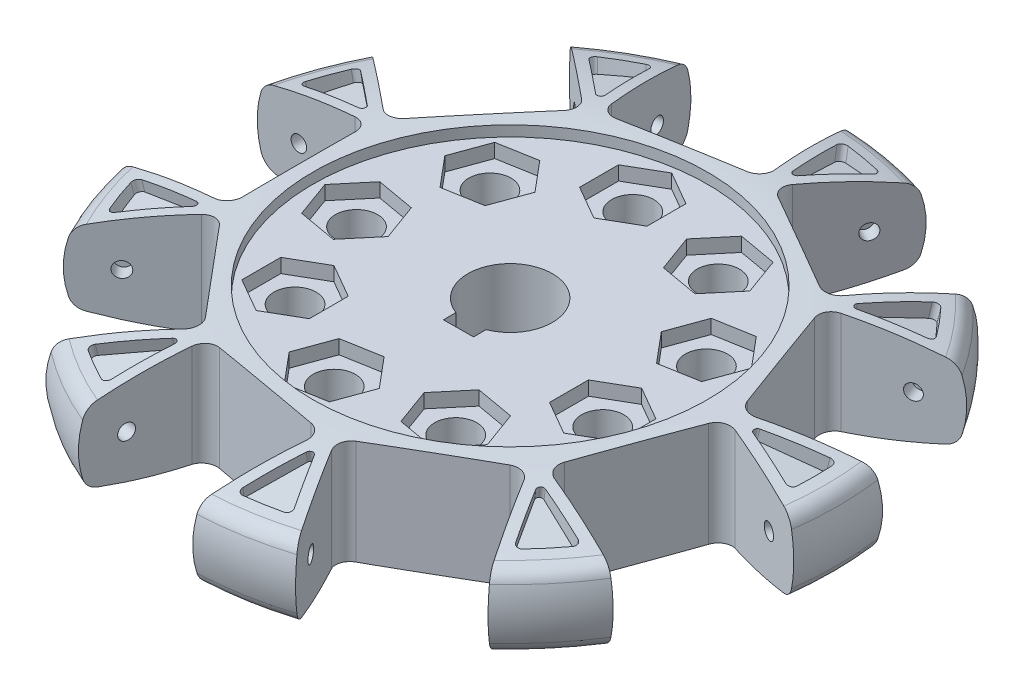
from build123d import *

# Parameters (mm, degrees)
CUT_EXTRUDE_1_DEPTH                = 69.974548261
PATTERN_CIRCULAR_1_COUNT           = 9
CUT_EXTRUDE_3_DEPTH                = 2
PATTERN_CIRCULAR_2_COUNT           = 9
PATTERN_CIRCULAR_2_COPY_1_DEPTH    = 2
PATTERN_CIRCULAR_2_COPY_2_DEPTH    = 2
PATTERN_CIRCULAR_2_COPY_3_DEPTH    = 2
PATTERN_CIRCULAR_2_COPY_4_DEPTH    = 2
PATTERN_CIRCULAR_2_COPY_5_DEPTH    = 2
PATTERN_CIRCULAR_2_COPY_6_DEPTH    = 2
PATTERN_CIRCULAR_2_COPY_7_DEPTH    = 2
PATTERN_CIRCULAR_2_COPY_8_DEPTH    = 2
SKETCH_6_R                         = 3
CUT_EXTRUDE_4_DEPTH                = 68.778705687
CUT_EXTRUDE_5_DEPTH                = 2
PATTERN_CIRCULAR_3_COUNT           = 9
SKETCH_9_R                         = 1.1
CUT_EXTRUDE_7_DEPTH                = 2
PATTERN_CIRCULAR_4_COUNT           = 9
PATTERN_CIRCULAR_4_COPY_1_SKETCH_R = 1.1
PATTERN_CIRCULAR_4_COPY_1_DEPTH    = 2
PATTERN_CIRCULAR_4_COPY_2_SKETCH_R = 1.1
PATTERN_CIRCULAR_4_COPY_2_DEPTH    = 2
PATTERN_CIRCULAR_4_COPY_3_SKETCH_R = 1.1
PATTERN_CIRCULAR_4_COPY_3_DEPTH    = 2
PATTERN_CIRCULAR_4_COPY_4_SKETCH_R = 1.1
PATTERN_CIRCULAR_4_COPY_4_DEPTH    = 2
PATTERN_CIRCULAR_4_COPY_5_SKETCH_R = 1.1
PATTERN_CIRCULAR_4_COPY_5_DEPTH    = 2
PATTERN_CIRCULAR_4_COPY_6_SKETCH_R = 1.1
PATTERN_CIRCULAR_4_COPY_6_DEPTH    = 2
PATTERN_CIRCULAR_4_COPY_7_SKETCH_R = 1.1
PATTERN_CIRCULAR_4_COPY_7_DEPTH    = 2
PATTERN_CIRCULAR_4_COPY_8_SKETCH_R = 1.1
PATTERN_CIRCULAR_4_COPY_8_DEPTH    = 2
CUT_EXTRUDE_8_DEPTH                = 68.778705687


with BuildPart() as part:
    # 草图1 → 旋转1 (revolve)
    with BuildSketch(Plane.XY):
        with BuildLine():
            Line((-6, 6.0015), (-6, -6.0015))
            Line((-6, -6.0015), (-28, -6.0015))
            Line((-28, -6.0015), (-28, -7.5))
            add(Edge.make_bspline(
                [(-28, -7.5), (-33.612534544, -7.506389819), (-39.182169701, -6.79075308), (-44.69778482, -5.353102439)],
                knots=[0, 0, 0, 0, 0.926994308, 0.926994308, 0.926994308, 0.926994308], degree=3))
            ThreePointArc((-44.69778482, -5.353102439), (-45.812153034, -4.7233276), (-46.46758639, -3.623855009))
            add(Edge.make_bspline(
                [(-46.473404583, 3.624485081), (-46.815442106, 2.431078638), (-47.156494807, -0.006033981), (-46.811568076, -2.419267682), (-46.46758639, -3.623855009)],
                knots=[0.139652253, 0.139652253, 0.139652253, 0.139652253, 0.501009303, 0.862385501, 0.862385501, 0.862385501, 0.862385501], degree=3))
            ThreePointArc((-46.473404583, 3.624485081), (-45.817862343, 4.722392286), (-44.70451169, 5.351348709))
            add(Edge.make_bspline(
                [(-28, 7.5), (-33.614833906, 7.506392396), (-39.186695198, 6.7901711), (-44.70451169, 5.351348709)],
                knots=[0, 0, 0, 0, 0.927371165, 0.927371165, 0.927371165, 0.927371165], degree=3))
            Line((-28, 7.5), (-28, 6.0015))
            Line((-28, 6.0015), (-6, 6.0015))
        make_face()
    revolve(axis=Axis((0, 18.348706493, 0), (0, -1, 0)))

    # 草图3 → 切除-拉伸1 (cut, through all)
    with BuildSketch(Plane(origin=(0, 11.0015, 0), x_dir=(1, 0, 0), z_dir=(0, 1, 0))):
        with BuildLine():
            Line((-46.435439053, 10), (-32, 10))
            ThreePointArc((-32, 10), (-30.585786438, 9.414213562), (-30, 8))
            Line((-30, 8), (-30, -8))
            ThreePointArc((-30, -8), (-30.585786438, -9.414213562), (-32, -10))
            Line((-32, -10), (-46.435439053, -10))
            ThreePointArc((-46.435439053, -10), (-47.5, 0), (-46.435439053, 10))
        make_face()
    cut_extrude_1 = extrude(amount=-CUT_EXTRUDE_1_DEPTH, mode=Mode.SUBTRACT)

    # 阵列(圆周)1: 切除-拉伸1 ×9 about axis
    pattern_circular_1_axis = Axis((0, 18.348706493, 0), (0, 1, 0))
    for i in range(1, PATTERN_CIRCULAR_1_COUNT):
        add(cut_extrude_1.rotate(pattern_circular_1_axis, i * 360 / PATTERN_CIRCULAR_1_COUNT), mode=Mode.SUBTRACT)

    # 草图5 → 切除-拉伸3 (cut)
    with BuildSketch(Plane(origin=(-2.912473789, 13.881841171, 0), x_dir=(-0.9786919477616355, -0.20533404828848112, -3.546150752329598e-15), z_dir=(-0.20533404828848112, 0.9786919477616355, -3.491481338843133e-15))):
        with BuildLine():
            Line((38.704667926, -11.5), (30.858037974, -11.5))
            ThreePointArc((30.858037974, -11.5), (30.374644137, -11.838841318), (30.528298333, -12.408818009))
            add(Edge.make_bspline(
                [(30.528298333, -12.408818009), (32.538191397, -14.088385517), (34.566082604, -15.757277023), (36.602034834, -17.407382848)],
                knots=[0.103336943, 0.103336943, 0.103336943, 0.103336943, 0.906001703, 0.906001703, 0.906001703, 0.906001703], degree=3))
            ThreePointArc((36.602034834, -17.407382848), (37.212548342, -17.542670381), (37.687590478, -17.136020125))
            add(Edge.make_bspline(
                [(37.687590478, -17.136020125), (38.013997426, -16.363529197), (38.622401583, -14.799746817), (39.140499829, -13.202223119), (39.376438976, -12.396783272)],
                knots=[0.134677988, 0.134677988, 0.134677988, 0.134677988, 0.5, 0.86497285, 0.86497285, 0.86497285, 0.86497285], degree=3))
            ThreePointArc((39.376438976, -12.396783272), (39.264912645, -11.78032649), (38.704667926, -11.5))
        make_face()
    cut_extrude_3 = extrude(amount=-CUT_EXTRUDE_3_DEPTH, mode=Mode.SUBTRACT)

    # 镜向1: 切除-拉伸3 across plane
    add(cut_extrude_3.mirror(Plane.ZX), mode=Mode.SUBTRACT)

    # 阵列(圆周)2: 切除-拉伸3 ×9 about axis
    pattern_circular_2_axis = Axis((0, 18.348706493, 0), (0, 1, 0))
    for i in range(1, PATTERN_CIRCULAR_2_COUNT):
        add(cut_extrude_3.rotate(pattern_circular_2_axis, i * 360 / PATTERN_CIRCULAR_2_COUNT), mode=Mode.SUBTRACT)

    # 阵列(圆周)2 copy 1 sketch → 阵列(圆周)2 copy 1 (cut)
    with BuildSketch(Plane(origin=(-2.231084362, -13.881841171, 1.872102065), x_dir=(-0.7497215281080923, 0.20533404828848112, 0.6290910577211624), z_dir=(-0.1572950066745171, -0.9786919477616355, 0.13198618208661053))):
        with BuildLine():
            Line((38.704667926, 11.5), (30.858037974, 11.5))
            ThreePointArc((30.858037974, 11.5), (30.374644137, 11.838841318), (30.528298333, 12.408818009))
            add(Edge.make_bspline(
                [(30.528298333, 12.408818009), (32.538191397, 14.088385517), (34.566082604, 15.757277023), (36.602034834, 17.407382848)],
                knots=[0.103336943, 0.103336943, 0.103336943, 0.103336943, 0.906001703, 0.906001703, 0.906001703, 0.906001703], degree=3))
            ThreePointArc((36.602034834, 17.407382848), (37.212548342, 17.542670381), (37.687590478, 17.136020125))
            add(Edge.make_bspline(
                [(37.687590478, 17.136020125), (38.013997426, 16.363529197), (38.622401583, 14.799746817), (39.140499829, 13.202223119), (39.376438976, 12.396783272)],
                knots=[0.134677988, 0.134677988, 0.134677988, 0.134677988, 0.5, 0.86497285, 0.86497285, 0.86497285, 0.86497285], degree=3))
            ThreePointArc((39.376438976, 12.396783272), (39.264912645, 11.78032649), (38.704667926, 11.5))
        make_face()
    extrude(amount=-PATTERN_CIRCULAR_2_COPY_1_DEPTH, mode=Mode.SUBTRACT)

    # 阵列(圆周)2 copy 2 sketch → 阵列(圆周)2 copy 2 (cut)
    with BuildSketch(Plane(origin=(-0.505745766, -13.881841171, 2.868226768), x_dir=(-0.16994807322611016, 0.20533404828848112, 0.9638234179662768), z_dir=(-0.03565588329827168, -0.9786919477616355, 0.2022145627118787))):
        with BuildLine():
            Line((38.704667926, 11.5), (30.858037974, 11.5))
            ThreePointArc((30.858037974, 11.5), (30.374644137, 11.838841318), (30.528298333, 12.408818009))
            add(Edge.make_bspline(
                [(30.528298333, 12.408818009), (32.538191397, 14.088385517), (34.566082604, 15.757277023), (36.602034834, 17.407382848)],
                knots=[0.103336943, 0.103336943, 0.103336943, 0.103336943, 0.906001703, 0.906001703, 0.906001703, 0.906001703], degree=3))
            ThreePointArc((36.602034834, 17.407382848), (37.212548342, 17.542670381), (37.687590478, 17.136020125))
            add(Edge.make_bspline(
                [(37.687590478, 17.136020125), (38.013997426, 16.363529197), (38.622401583, 14.799746817), (39.140499829, 13.202223119), (39.376438976, 12.396783272)],
                knots=[0.134677988, 0.134677988, 0.134677988, 0.134677988, 0.5, 0.86497285, 0.86497285, 0.86497285, 0.86497285], degree=3))
            ThreePointArc((39.376438976, 12.396783272), (39.264912645, 11.78032649), (38.704667926, 11.5))
        make_face()
    extrude(amount=-PATTERN_CIRCULAR_2_COPY_2_DEPTH, mode=Mode.SUBTRACT)

    # 阵列(圆周)2 copy 3 sketch → 阵列(圆周)2 copy 3 (cut)
    with BuildSketch(Plane(origin=(1.456236894, -13.881841171, 2.522276289), x_dir=(0.48934597388081447, 0.20533404828848112, 0.8475720892408509), z_dir=(0.10266702414423749, -0.9786919477616355, 0.17782450207972705))):
        with BuildLine():
            Line((38.704667926, 11.5), (30.858037974, 11.5))
            ThreePointArc((30.858037974, 11.5), (30.374644137, 11.838841318), (30.528298333, 12.408818009))
            add(Edge.make_bspline(
                [(30.528298333, 12.408818009), (32.538191397, 14.088385517), (34.566082604, 15.757277023), (36.602034834, 17.407382848)],
                knots=[0.103336943, 0.103336943, 0.103336943, 0.103336943, 0.906001703, 0.906001703, 0.906001703, 0.906001703], degree=3))
            ThreePointArc((36.602034834, 17.407382848), (37.212548342, 17.542670381), (37.687590478, 17.136020125))
            add(Edge.make_bspline(
                [(37.687590478, 17.136020125), (38.013997426, 16.363529197), (38.622401583, 14.799746817), (39.140499829, 13.202223119), (39.376438976, 12.396783272)],
                knots=[0.134677988, 0.134677988, 0.134677988, 0.134677988, 0.5, 0.86497285, 0.86497285, 0.86497285, 0.86497285], degree=3))
            ThreePointArc((39.376438976, 12.396783272), (39.264912645, 11.78032649), (38.704667926, 11.5))
        make_face()
    extrude(amount=-PATTERN_CIRCULAR_2_COPY_3_DEPTH, mode=Mode.SUBTRACT)

    # 阵列(圆周)2 copy 4 sketch → 阵列(圆周)2 copy 4 (cut)
    with BuildSketch(Plane(origin=(2.736830128, -13.881841171, 0.996124703), x_dir=(0.9196696013341953, 0.20533404828848112, 0.33473236024511593), z_dir=(0.19295088997278187, -0.9786919477616355, 0.0702283806252694))):
        with BuildLine():
            Line((38.704667926, 11.5), (30.858037974, 11.5))
            ThreePointArc((30.858037974, 11.5), (30.374644137, 11.838841318), (30.528298333, 12.408818009))
            add(Edge.make_bspline(
                [(30.528298333, 12.408818009), (32.538191397, 14.088385517), (34.566082604, 15.757277023), (36.602034834, 17.407382848)],
                knots=[0.103336943, 0.103336943, 0.103336943, 0.103336943, 0.906001703, 0.906001703, 0.906001703, 0.906001703], degree=3))
            ThreePointArc((36.602034834, 17.407382848), (37.212548342, 17.542670381), (37.687590478, 17.136020125))
            add(Edge.make_bspline(
                [(37.687590478, 17.136020125), (38.013997426, 16.363529197), (38.622401583, 14.799746817), (39.140499829, 13.202223119), (39.376438976, 12.396783272)],
                knots=[0.134677988, 0.134677988, 0.134677988, 0.134677988, 0.5, 0.86497285, 0.86497285, 0.86497285, 0.86497285], degree=3))
            ThreePointArc((39.376438976, 12.396783272), (39.264912645, 11.78032649), (38.704667926, 11.5))
        make_face()
    extrude(amount=-PATTERN_CIRCULAR_2_COPY_4_DEPTH, mode=Mode.SUBTRACT)

    # 阵列(圆周)2 copy 5 sketch → 阵列(圆周)2 copy 5 (cut)
    with BuildSketch(Plane(origin=(2.736830128, -13.881841171, -0.996124703), x_dir=(0.9196696013341978, 0.20533404828848112, -0.33473236024510905), z_dir=(0.19295088997278428, -0.9786919477616355, -0.0702283806252628))):
        with BuildLine():
            Line((38.704667926, 11.5), (30.858037974, 11.5))
            ThreePointArc((30.858037974, 11.5), (30.374644137, 11.838841318), (30.528298333, 12.408818009))
            add(Edge.make_bspline(
                [(30.528298333, 12.408818009), (32.538191397, 14.088385517), (34.566082604, 15.757277023), (36.602034834, 17.407382848)],
                knots=[0.103336943, 0.103336943, 0.103336943, 0.103336943, 0.906001703, 0.906001703, 0.906001703, 0.906001703], degree=3))
            ThreePointArc((36.602034834, 17.407382848), (37.212548342, 17.542670381), (37.687590478, 17.136020125))
            add(Edge.make_bspline(
                [(37.687590478, 17.136020125), (38.013997426, 16.363529197), (38.622401583, 14.799746817), (39.140499829, 13.202223119), (39.376438976, 12.396783272)],
                knots=[0.134677988, 0.134677988, 0.134677988, 0.134677988, 0.5, 0.86497285, 0.86497285, 0.86497285, 0.86497285], degree=3))
            ThreePointArc((39.376438976, 12.396783272), (39.264912645, 11.78032649), (38.704667926, 11.5))
        make_face()
    extrude(amount=-PATTERN_CIRCULAR_2_COPY_5_DEPTH, mode=Mode.SUBTRACT)

    # 阵列(圆周)2 copy 6 sketch → 阵列(圆周)2 copy 6 (cut)
    with BuildSketch(Plane(origin=(1.456236894, -13.881841171, -2.522276289), x_dir=(0.48934597388082124, 0.20533404828848112, -0.847572089240847), z_dir=(0.10266702414424368, -0.9786919477616355, -0.17782450207972347))):
        with BuildLine():
            Line((38.704667926, 11.5), (30.858037974, 11.5))
            ThreePointArc((30.858037974, 11.5), (30.374644137, 11.838841318), (30.528298333, 12.408818009))
            add(Edge.make_bspline(
                [(30.528298333, 12.408818009), (32.538191397, 14.088385517), (34.566082604, 15.757277023), (36.602034834, 17.407382848)],
                knots=[0.103336943, 0.103336943, 0.103336943, 0.103336943, 0.906001703, 0.906001703, 0.906001703, 0.906001703], degree=3))
            ThreePointArc((36.602034834, 17.407382848), (37.212548342, 17.542670381), (37.687590478, 17.136020125))
            add(Edge.make_bspline(
                [(37.687590478, 17.136020125), (38.013997426, 16.363529197), (38.622401583, 14.799746817), (39.140499829, 13.202223119), (39.376438976, 12.396783272)],
                knots=[0.134677988, 0.134677988, 0.134677988, 0.134677988, 0.5, 0.86497285, 0.86497285, 0.86497285, 0.86497285], degree=3))
            ThreePointArc((39.376438976, 12.396783272), (39.264912645, 11.78032649), (38.704667926, 11.5))
        make_face()
    extrude(amount=-PATTERN_CIRCULAR_2_COPY_6_DEPTH, mode=Mode.SUBTRACT)

    # 阵列(圆周)2 copy 7 sketch → 阵列(圆周)2 copy 7 (cut)
    with BuildSketch(Plane(origin=(-0.505745766, -13.881841171, -2.868226768), x_dir=(-0.16994807322610272, 0.20533404828848112, -0.9638234179662782), z_dir=(-0.035655883298264704, -0.9786919477616355, -0.20221456271187993))):
        with BuildLine():
            Line((38.704667926, 11.5), (30.858037974, 11.5))
            ThreePointArc((30.858037974, 11.5), (30.374644137, 11.838841318), (30.528298333, 12.408818009))
            add(Edge.make_bspline(
                [(30.528298333, 12.408818009), (32.538191397, 14.088385517), (34.566082604, 15.757277023), (36.602034834, 17.407382848)],
                knots=[0.103336943, 0.103336943, 0.103336943, 0.103336943, 0.906001703, 0.906001703, 0.906001703, 0.906001703], degree=3))
            ThreePointArc((36.602034834, 17.407382848), (37.212548342, 17.542670381), (37.687590478, 17.136020125))
            add(Edge.make_bspline(
                [(37.687590478, 17.136020125), (38.013997426, 16.363529197), (38.622401583, 14.799746817), (39.140499829, 13.202223119), (39.376438976, 12.396783272)],
                knots=[0.134677988, 0.134677988, 0.134677988, 0.134677988, 0.5, 0.86497285, 0.86497285, 0.86497285, 0.86497285], degree=3))
            ThreePointArc((39.376438976, 12.396783272), (39.264912645, 11.78032649), (38.704667926, 11.5))
        make_face()
    extrude(amount=-PATTERN_CIRCULAR_2_COPY_7_DEPTH, mode=Mode.SUBTRACT)

    # 阵列(圆周)2 copy 8 sketch → 阵列(圆周)2 copy 8 (cut)
    with BuildSketch(Plane(origin=(-2.231084362, -13.881841171, -1.872102065), x_dir=(-0.7497215281080875, 0.20533404828848112, -0.629091057721168), z_dir=(-0.15729500667451257, -0.9786919477616355, -0.13198618208661594))):
        with BuildLine():
            Line((38.704667926, 11.5), (30.858037974, 11.5))
            ThreePointArc((30.858037974, 11.5), (30.374644137, 11.838841318), (30.528298333, 12.408818009))
            add(Edge.make_bspline(
                [(30.528298333, 12.408818009), (32.538191397, 14.088385517), (34.566082604, 15.757277023), (36.602034834, 17.407382848)],
                knots=[0.103336943, 0.103336943, 0.103336943, 0.103336943, 0.906001703, 0.906001703, 0.906001703, 0.906001703], degree=3))
            ThreePointArc((36.602034834, 17.407382848), (37.212548342, 17.542670381), (37.687590478, 17.136020125))
            add(Edge.make_bspline(
                [(37.687590478, 17.136020125), (38.013997426, 16.363529197), (38.622401583, 14.799746817), (39.140499829, 13.202223119), (39.376438976, 12.396783272)],
                knots=[0.134677988, 0.134677988, 0.134677988, 0.134677988, 0.5, 0.86497285, 0.86497285, 0.86497285, 0.86497285], degree=3))
            ThreePointArc((39.376438976, 12.396783272), (39.264912645, 11.78032649), (38.704667926, 11.5))
        make_face()
    extrude(amount=-PATTERN_CIRCULAR_2_COPY_8_DEPTH, mode=Mode.SUBTRACT)

    # 草图6 → 切除-拉伸4 (cut, through all)
    with BuildSketch(Plane(origin=(0, 6.0015, 0), x_dir=(1, 0, 0), z_dir=(0, 1, 0))):
        with Locations((20.408115722, -7.271450504)):
            Circle(SKETCH_6_R)
    cut_extrude_4 = extrude(amount=-CUT_EXTRUDE_4_DEPTH, mode=Mode.SUBTRACT)

    # 草图7 → 切除-拉伸5 (cut)
    with BuildSketch(Plane(origin=(0, 6.0015, 0), x_dir=(1, 0, 0), z_dir=(0, 1, 0))):
        Polygon((15.623325366, -10.033950504), (20.408115722, -12.796450504), (25.192906078, -10.033950504), (25.192906078, -4.508950504), (20.408115722, -1.746450504), (15.623325366, -4.508950504), align=None)
    cut_extrude_5 = extrude(amount=-CUT_EXTRUDE_5_DEPTH, mode=Mode.SUBTRACT)

    # 阵列(圆周)3: 切除-拉伸4, 切除-拉伸5 ×9 about axis
    pattern_circular_3_axis = Axis((0, 18.348706493, 0), (0, 1, 0))
    add([cut_extrude_4.rotate(pattern_circular_3_axis, i * 360 / PATTERN_CIRCULAR_3_COUNT) for i in range(1, PATTERN_CIRCULAR_3_COUNT)], mode=Mode.SUBTRACT)
    add([cut_extrude_5.rotate(pattern_circular_3_axis, i * 360 / PATTERN_CIRCULAR_3_COUNT) for i in range(1, PATTERN_CIRCULAR_3_COUNT)], mode=Mode.SUBTRACT)

    # 草图9 → 切除-拉伸7 (cut)
    with BuildSketch(Plane(origin=(9.84807753, 0, 1.736481777), x_dir=(-0.17364817766693996, 0, 0.9848077530122064), z_dir=(-0.9848077530122064, 0, -0.17364817766693996))):
        with Locations((40, 0)):
            Circle(SKETCH_9_R)
    cut_extrude_7 = extrude(amount=-CUT_EXTRUDE_7_DEPTH, mode=Mode.SUBTRACT)

    # 镜向5: 切除-拉伸7 across plane
    add(cut_extrude_7.mirror(Plane(origin=(0, 0, 0), x_dir=(-0.17364817766694024, 0, 0.9848077530122062), z_dir=(-0.9848077530122064, 0, -0.17364817766694024))), mode=Mode.SUBTRACT)

    # 阵列(圆周)4: 切除-拉伸7 ×9 about axis
    pattern_circular_4_axis = Axis((0, 18.348706493, 0), (0, 1, 0))
    for i in range(1, PATTERN_CIRCULAR_4_COUNT):
        add(cut_extrude_7.rotate(pattern_circular_4_axis, i * 360 / PATTERN_CIRCULAR_4_COUNT), mode=Mode.SUBTRACT)

    # 阵列(圆周)4 copy 1 sketch → 阵列(圆周)4 copy 1 (cut)
    with BuildSketch(Plane(origin=(-8.660254038, 0, 5), x_dir=(0.499999999999991, 0, 0.8660254037844437), z_dir=(0.866025403784444, 0, -0.4999999999999911))):
        with Locations((40, 0)):
            Circle(PATTERN_CIRCULAR_4_COPY_1_SKETCH_R)
    extrude(amount=-PATTERN_CIRCULAR_4_COPY_1_DEPTH, mode=Mode.SUBTRACT)

    # 阵列(圆周)4 copy 2 sketch → 阵列(圆周)4 copy 2 (cut)
    with BuildSketch(Plane(origin=(-3.420201433, 0, 9.396926208), x_dir=(0.9396926207859049, 0, 0.34202014332567854), z_dir=(0.34202014332567854, 0, -0.9396926207859051))):
        with Locations((40, 0)):
            Circle(PATTERN_CIRCULAR_4_COPY_2_SKETCH_R)
    extrude(amount=-PATTERN_CIRCULAR_4_COPY_2_DEPTH, mode=Mode.SUBTRACT)

    # 阵列(圆周)4 copy 3 sketch → 阵列(圆周)4 copy 3 (cut)
    with BuildSketch(Plane(origin=(3.420201433, 0, 9.396926208), x_dir=(0.939692620785912, 0, -0.34202014332565883), z_dir=(-0.3420201433256589, 0, -0.9396926207859122))):
        with Locations((40, 0)):
            Circle(PATTERN_CIRCULAR_4_COPY_3_SKETCH_R)
    extrude(amount=-PATTERN_CIRCULAR_4_COPY_3_DEPTH, mode=Mode.SUBTRACT)

    # 阵列(圆周)4 copy 4 sketch → 阵列(圆周)4 copy 4 (cut)
    with BuildSketch(Plane(origin=(8.660254038, 0, 5), x_dir=(0.500000000000009, 0, -0.8660254037844334), z_dir=(-0.8660254037844336, 0, -0.5000000000000091))):
        with Locations((40, 0)):
            Circle(PATTERN_CIRCULAR_4_COPY_4_SKETCH_R)
    extrude(amount=-PATTERN_CIRCULAR_4_COPY_4_DEPTH, mode=Mode.SUBTRACT)

    # 阵列(圆周)4 copy 5 sketch → 阵列(圆周)4 copy 5 (cut)
    with BuildSketch(Plane(origin=(9.84807753, 0, -1.736481777), x_dir=(-0.1736481776669201, 0, -0.9848077530122098), z_dir=(-0.9848077530122101, 0, 0.17364817766692017))):
        with Locations((40, 0)):
            Circle(PATTERN_CIRCULAR_4_COPY_5_SKETCH_R)
    extrude(amount=-PATTERN_CIRCULAR_4_COPY_5_DEPTH, mode=Mode.SUBTRACT)

    # 阵列(圆周)4 copy 6 sketch → 阵列(圆周)4 copy 6 (cut)
    with BuildSketch(Plane(origin=(6.427876097, 0, -7.660444431), x_dir=(-0.766044443118971, 0, -0.6427876096865477), z_dir=(-0.6427876096865478, 0, 0.7660444431189712))):
        with Locations((40, 0)):
            Circle(PATTERN_CIRCULAR_4_COPY_6_SKETCH_R)
    extrude(amount=-PATTERN_CIRCULAR_4_COPY_6_DEPTH, mode=Mode.SUBTRACT)

    # 阵列(圆周)4 copy 7 sketch → 阵列(圆周)4 copy 7 (cut)
    with BuildSketch(Plane(origin=(0, 0, -10), x_dir=(-1, 0, 0), z_dir=(0, 0, 1))):
        with Locations((40, 0)):
            Circle(PATTERN_CIRCULAR_4_COPY_7_SKETCH_R)
    extrude(amount=-PATTERN_CIRCULAR_4_COPY_7_DEPTH, mode=Mode.SUBTRACT)

    # 阵列(圆周)4 copy 8 sketch → 阵列(圆周)4 copy 8 (cut)
    with BuildSketch(Plane(origin=(-6.427876097, 0, -7.660444431), x_dir=(-0.7660444431189848, 0, 0.6427876096865313), z_dir=(0.6427876096865313, 0, 0.766044443118985))):
        with Locations((40, 0)):
            Circle(PATTERN_CIRCULAR_4_COPY_8_SKETCH_R)
    extrude(amount=-PATTERN_CIRCULAR_4_COPY_8_DEPTH, mode=Mode.SUBTRACT)

    # 草图10 → 切除-拉伸8 (cut, through all)
    with BuildSketch(Plane.XZ.offset(6.0015)):
        Polygon((2.171322722, 5.593331533), (2.186644791, 7.376860171), (-2.059584063, 7.413338986), (-2.074906131, 5.629810347), align=None)
    extrude(amount=-CUT_EXTRUDE_8_DEPTH, mode=Mode.SUBTRACT)


solid = part.part
